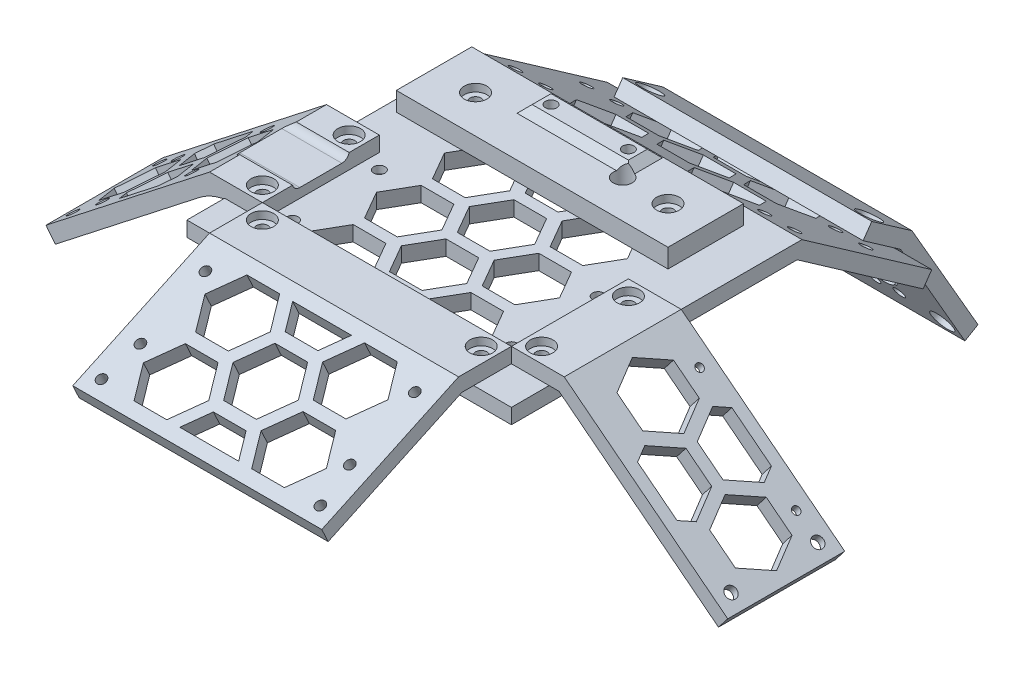
from build123d import *

# Parameters (mm, degrees)
SKETCH2_W                        = 72
SKETCH2_H                        = 20
BOSS_EXTRUDE1_DEPTH              = 5
SKETCH1_R                        = 6
SKETCH1_R_2                      = 3
BOSS_EXTRUDE2_DEPTH              = 4
SKETCH3_R                        = 1.5
CUT_EXTRUDE1_DEPTH               = 39.431757701
SKETCH4_R                        = 3
CUT_EXTRUDE2_DEPTH               = 2
SKETCH6_R                        = 1.3
SKETCH6_R_2                      = 1.5
BOSS_EXTRUDE4_DEPTH              = 4
SKETCH8_R                        = 2.5
CUT_EXTRUDE3_DEPTH               = 74.042795675
SKETCH10_R                       = 1.5
CUT_EXTRUDE4_DEPTH               = 5
BOSS_EXTRUDE6_START              = 2
SKETCH11_W                       = 25.5
SKETCH11_H                       = 5
SKETCH11_R                       = 1.5
BOSS_EXTRUDE6_DEPTH              = 2
SKETCH12_R                       = 3
CUT_EXTRUDE5_DEPTH               = 2
CUT_EXTRUDE6_START               = -2
SKETCH14_R                       = 3
CUT_EXTRUDE6_DEPTH               = 2
SKETCH15_W                       = 14
SKETCH15_H                       = 31
SKETCH15_R                       = 1.5
BOSS_EXTRUDE7_DEPTH              = 4
BOSS_EXTRUDE8_DEPTH              = 31
SKETCH18_R                       = 3
CUT_EXTRUDE7_DEPTH               = 2
SKETCH19_R                       = 1.5
CUT_EXTRUDE8_DEPTH               = 111.725400051
SKETCH20_R                       = 3
CUT_EXTRUDE9_DEPTH               = 2
SKETCH21_W                       = 66
SKETCH21_H                       = 14
SKETCH21_R                       = 1.5
BOSS_EXTRUDE9_DEPTH              = 4
SKETCH22_R                       = 3
CUT_EXTRUDE10_DEPTH              = 2
BOSS_EXTRUDE10_DEPTH             = 66
SKETCH25_W                       = 57.340591448
SKETCH25_H                       = 15
CUT_EXTRUDE11_DEPTH              = 1.5
FILLET1_R                        = 2
FILLET2_R                        = 15
SKETCH28_R                       = 1.25
CUT_EXTRUDE12_DEPTH              = 4
CUT_EXTRUDE13_DEPTH              = 4
SKETCH30_W                       = 14
SKETCH30_H                       = 31
SKETCH30_R                       = 1.5
BOSS_EXTRUDE11_DEPTH             = 4
BOSS_EXTRUDE12_DEPTH             = 31
SKETCH32_R                       = 1.5
SKETCH32_R_2                     = 1
CUT_EXTRUDE14_DEPTH              = 4
CUT_EXTRUDE15_DEPTH              = 4
SKETCH34_R                       = 3
SKETCH34_R_2                     = 2.5
CUT_EXTRUDE16_DEPTH              = 2
CUT_EXTRUDE17_DEPTH              = 4
SKETCH37_R                       = 3
CUT_EXTRUDE19_DEPTH              = 2
SKETCH38_W                       = 86
SKETCH38_H                       = 40
CUT_EXTRUDE20_DEPTH              = 138.852557687
BOSS_EXTRUDE13_REACH             = 140.865
BOSS_EXTRUDE13_DIRECTION_2_REACH = 140.865
SKETCH40_R                       = 1.5
CUT_EXTRUDE21_DEPTH              = 4
CUT_EXTRUDE22_DEPTH              = 2
CUT_EXTRUDE23_DEPTH              = 4
CUT_EXTRUDE24_DEPTH              = 4
SKETCH44_W                       = 66
SKETCH44_H                       = 13
SKETCH44_R                       = 1.5
BOSS_EXTRUDE14_DEPTH             = 4
BOSS_EXTRUDE15_DEPTH             = 66
SKETCH48_R                       = 1.5
CUT_EXTRUDE25_DEPTH              = 4
SKETCH49_R                       = 3
CUT_EXTRUDE26_DEPTH              = 2
SKETCH51_R                       = 3
CUT_EXTRUDE28_DEPTH              = 2


with BuildPart() as part:
    # Sketch2 → Boss-Extrude1 (new body)
    with BuildSketch(Plane(origin=(0, 0, 0), x_dir=(1, 0, 0), z_dir=(0, 1, 0))):
        Rectangle(SKETCH2_W, SKETCH2_H)
    extrude(amount=BOSS_EXTRUDE1_DEPTH)

    # Sketch1 → Boss-Extrude2 (add)
    with BuildSketch(Plane(origin=(0, 0, 0), x_dir=(1, 0, 0), z_dir=(0, 1, 0))):
        with Locations(Location((-25, 0, 0), (0, 0, 270))):
            Circle(SKETCH1_R)
        with Locations(Location((26, 0, 0), (0, 0, 270))):
            Circle(SKETCH1_R_2)
    extrude(amount=-BOSS_EXTRUDE2_DEPTH)

    # Sketch3 → Cut-Extrude1 (cut, through all)
    with BuildSketch(Plane.XZ.offset(4)):
        with Locations(Location((-25, 0, 0), (0, 0, 270))):
            Circle(SKETCH3_R)
        with Locations(Location((26, 0, 0), (0, 0, 270))):
            Circle(SKETCH3_R)
    extrude(amount=-CUT_EXTRUDE1_DEPTH, mode=Mode.SUBTRACT)

    # Sketch4 → Cut-Extrude2 (cut)
    with BuildSketch(Plane(origin=(0, 5, 0), x_dir=(1, 0, 0), z_dir=(0, 1, 0))):
        with Locations(Location((-25, 0, 0), (0, 0, 270))):
            Circle(SKETCH4_R)
        with Locations(Location((26, 0, 0), (0, 0, 270))):
            Circle(SKETCH4_R)
    extrude(amount=-CUT_EXTRUDE2_DEPTH, mode=Mode.SUBTRACT)

    # Sketch8 → Cut-Extrude3 (cut, through all)
    with BuildSketch(Plane.XZ):
        with Locations(Location((14, 0, 0), (0, 0, 270))):
            Circle(SKETCH8_R)
    extrude(amount=-CUT_EXTRUDE3_DEPTH, mode=Mode.SUBTRACT)

    # Sketch10 → Cut-Extrude4 (cut)
    with BuildSketch(Plane(origin=(0, 5, 0), x_dir=(1, 0, 0), z_dir=(0, 1, 0))):
        with Locations(Location((-10.25, 5.25, 0), (0, 0, 270))):
            Circle(SKETCH10_R)
        with Locations(Location((10.25, 5.25, 0), (0, 0, 270))):
            Circle(SKETCH10_R)
    extrude(amount=-CUT_EXTRUDE4_DEPTH, mode=Mode.SUBTRACT)

    # Sketch11 → Boss-Extrude6 (add)
    with BuildSketch(Plane(origin=(0, 5, 0), x_dir=(1, 0, 0), z_dir=(0, 1, 0)).offset(BOSS_EXTRUDE6_START)):
        with Locations((0, 5.25)):
            Rectangle(SKETCH11_W, SKETCH11_H)
        with Locations(Location((-10.25, 5.25, 0), (0, 0, 270))):
            Circle(SKETCH11_R, mode=Mode.SUBTRACT)
        with Locations(Location((10.25, 5.25, 0), (0, 0, 270))):
            Circle(SKETCH11_R, mode=Mode.SUBTRACT)
    extrude(amount=-BOSS_EXTRUDE6_DEPTH)

    # Chamfer2
    # the kernel refuses this chamfer: 2 mm, written as the material it adds along each edge
    with BuildSketch(Plane(origin=(-12.75, 5, -2.75), x_dir=(0, -0.027495876610586487, 0.9996219169112968), z_dir=(1, 0, 0))) as chamfer2_piece_1_section:
        with BuildLine():
            Line((2.05734639, 0), (-0.11309431, -2.054235587))
            Line((-0.11309431, -2.054235587), (-0.153079186, -2.053135752))
            ThreePointArc((-0.153079186, -2.053135752), (-0.068258454, -1.026795659), (-0.039984877, 0.001099835))
            Line((-0.039984877, 0.001099835), (0.001099835, 0.039984877))
            ThreePointArc((0.001099835, 0.039984877), (1.028995329, 0.011711299), (2.058446225, 0.039984877))
            Line((2.058446225, 0.039984877), (2.05734639, 0))
        make_face()
    chamfer2_piece_1 = extrude(amount=25.5, mode=Mode.PRIVATE)
    chamfer2_piece_1 = chamfer2_piece_1 - Plane(origin=(14, 5.660762518, 0), x_dir=(0, 0, -1), z_dir=(0, -1, 0)) * Cylinder(2.5, 60, mode=Mode.PRIVATE)
    chamfer2_piece_1 = split(chamfer2_piece_1, bisect_by=Plane(origin=(-0.134065272, 7, -2.095887334), z_dir=(0, -1, 0)), keep=Keep.TOP, mode=Mode.PRIVATE)
    add(chamfer2_piece_1)
    with BuildSketch(Plane(origin=(12.75, 5, -2.75), x_dir=(0.9996219169112968, -0.027495876610586487, 0), z_dir=(0, 0, -1))) as chamfer2_piece_2_section:
        with BuildLine():
            Line((2.05734639, 0), (-0.11309431, -2.054235587))
            Line((-0.11309431, -2.054235587), (-0.153079186, -2.053135752))
            ThreePointArc((-0.153079186, -2.053135752), (-0.068258454, -1.026795659), (-0.039984877, 0.001099835))
            Line((-0.039984877, 0.001099835), (0.001099835, 0.039984877))
            ThreePointArc((0.001099835, 0.039984877), (1.028995329, 0.011711299), (2.058446225, 0.039984877))
            Line((2.058446225, 0.039984877), (2.05734639, 0))
        make_face()
    chamfer2_piece_2 = extrude(amount=5, mode=Mode.PRIVATE)
    chamfer2_piece_2 = split(chamfer2_piece_2, bisect_by=Plane(origin=(13.410808309, 7, -5.25), z_dir=(0, -1, 0)), keep=Keep.TOP, mode=Mode.PRIVATE)
    add(chamfer2_piece_2)
    with BuildSketch(Plane(origin=(12.75, 5, -7.75), x_dir=(0, -0.027495876610586487, -0.9996219169112968), z_dir=(-1, 0, 0))) as chamfer2_piece_3_section:
        with BuildLine():
            Line((2.05734639, 0), (-0.11309431, -2.054235587))
            Line((-0.11309431, -2.054235587), (-0.153079186, -2.053135752))
            ThreePointArc((-0.153079186, -2.053135752), (-0.068258454, -1.026795659), (-0.039984877, 0.001099835))
            Line((-0.039984877, 0.001099835), (0.001099835, 0.039984877))
            ThreePointArc((0.001099835, 0.039984877), (1.028995329, 0.011711299), (2.058446225, 0.039984877))
            Line((2.058446225, 0.039984877), (2.05734639, 0))
        make_face()
    chamfer2_piece_3 = extrude(amount=25.5, mode=Mode.PRIVATE)
    chamfer2_piece_3 = split(chamfer2_piece_3, bisect_by=Plane(origin=(0, 7, -8.410808309), z_dir=(0, -1, 0)), keep=Keep.TOP, mode=Mode.PRIVATE)
    add(chamfer2_piece_3)
    with BuildSketch(Plane(origin=(-12.75, 5, -7.75), x_dir=(-0.9996219169112968, -0.027495876610586487, 0), z_dir=(0, 0, 1))) as chamfer2_piece_4_section:
        with BuildLine():
            Line((2.05734639, 0), (-0.11309431, -2.054235587))
            Line((-0.11309431, -2.054235587), (-0.153079186, -2.053135752))
            ThreePointArc((-0.153079186, -2.053135752), (-0.068258454, -1.026795659), (-0.039984877, 0.001099835))
            Line((-0.039984877, 0.001099835), (0.001099835, 0.039984877))
            ThreePointArc((0.001099835, 0.039984877), (1.028995329, 0.011711299), (2.058446225, 0.039984877))
            Line((2.058446225, 0.039984877), (2.05734639, 0))
        make_face()
    chamfer2_piece_4 = extrude(amount=5, mode=Mode.PRIVATE)
    chamfer2_piece_4 = split(chamfer2_piece_4, bisect_by=Plane(origin=(-13.410808309, 7, -5.25), z_dir=(0, -1, 0)), keep=Keep.TOP, mode=Mode.PRIVATE)
    add(chamfer2_piece_4)
    with BuildSketch(Plane(origin=(-12.75, 5, -7.75), x_dir=(-0.9996219169112968, -0.027495876610586487, 0), z_dir=(0, 0, 1))) as chamfer2_piece_5a_section:
        with BuildLine():
            Line((2.05734639, 0), (-0.11309431, -2.054235587))
            Line((-0.11309431, -2.054235587), (-0.153079186, -2.053135752))
            ThreePointArc((-0.153079186, -2.053135752), (-0.068258454, -1.026795659), (-0.039984877, 0.001099835))
            Line((-0.039984877, 0.001099835), (0.001099835, 0.039984877))
            ThreePointArc((0.001099835, 0.039984877), (1.028995329, 0.011711299), (2.058446225, 0.039984877))
            Line((2.058446225, 0.039984877), (2.05734639, 0))
        make_face()
    chamfer2_piece_5a = extrude(amount=7.05734639, mode=Mode.PRIVATE)
    chamfer2_piece_5a = split(chamfer2_piece_5a, bisect_by=Plane(origin=(-13.410808309, 7, -1.721326805), z_dir=(0, -1, 0)), keep=Keep.TOP, mode=Mode.PRIVATE)
    chamfer2_piece_5a = split(chamfer2_piece_5a, bisect_by=Plane(origin=(-13.410808309, 5.657268668, -2.75), z_dir=(0, 0, 1)), keep=Keep.TOP, mode=Mode.PRIVATE)
    with BuildSketch(Plane(origin=(-14.80734639, 5, -2.75), x_dir=(0, -0.027495876610586487, 0.9996219169112968), z_dir=(1, 0, 0))) as chamfer2_piece_5b_section:
        with BuildLine():
            Line((2.05734639, 0), (-0.11309431, -2.054235587))
            Line((-0.11309431, -2.054235587), (-0.153079186, -2.053135752))
            ThreePointArc((-0.153079186, -2.053135752), (-0.068258454, -1.026795659), (-0.039984877, 0.001099835))
            Line((-0.039984877, 0.001099835), (0.001099835, 0.039984877))
            ThreePointArc((0.001099835, 0.039984877), (1.028995329, 0.011711299), (2.058446225, 0.039984877))
            Line((2.058446225, 0.039984877), (2.05734639, 0))
        make_face()
    chamfer2_piece_5b = extrude(amount=27.55734639, mode=Mode.PRIVATE)
    chamfer2_piece_5b = split(chamfer2_piece_5b, bisect_by=Plane(origin=(-13.778673195, 7, -2.089191691), z_dir=(0, -1, 0)), keep=Keep.TOP, mode=Mode.PRIVATE)
    chamfer2_piece_5b = split(chamfer2_piece_5b, bisect_by=Plane(origin=(-12.75, 5.657268668, -2.089191691), z_dir=(-1, 0, 0)), keep=Keep.TOP, mode=Mode.PRIVATE)
    chamfer2_piece_5 = chamfer2_piece_5a & chamfer2_piece_5b
    add(chamfer2_piece_5)
    with BuildSketch(Plane(origin=(-12.75, 5, -2.75), x_dir=(0, -0.027495876610586487, 0.9996219169112968), z_dir=(1, 0, 0))) as chamfer2_piece_6a_section:
        with BuildLine():
            Line((2.05734639, 0), (-0.11309431, -2.054235587))
            Line((-0.11309431, -2.054235587), (-0.153079186, -2.053135752))
            ThreePointArc((-0.153079186, -2.053135752), (-0.068258454, -1.026795659), (-0.039984877, 0.001099835))
            Line((-0.039984877, 0.001099835), (0.001099835, 0.039984877))
            ThreePointArc((0.001099835, 0.039984877), (1.028995329, 0.011711299), (2.058446225, 0.039984877))
            Line((2.058446225, 0.039984877), (2.05734639, 0))
        make_face()
    chamfer2_piece_6a = extrude(amount=27.55734639, mode=Mode.PRIVATE)
    chamfer2_piece_6a = chamfer2_piece_6a - Plane(origin=(14, 5.933617383, 0), x_dir=(0, 0, -1), z_dir=(0, -1, 0)) * Cylinder(2.5, 64, mode=Mode.PRIVATE)
    chamfer2_piece_6a = split(chamfer2_piece_6a, bisect_by=Plane(origin=(13.702845422, 7, -2.606312664), z_dir=(0, -1, 0)), keep=Keep.TOP, mode=Mode.PRIVATE)
    chamfer2_piece_6a = split(chamfer2_piece_6a, bisect_by=Plane(origin=(12.75, 5.933617383, -2.606312664), z_dir=(1, 0, 0)), keep=Keep.TOP, mode=Mode.PRIVATE)
    with BuildSketch(Plane(origin=(12.75, 5, -0.69265361), x_dir=(0.9996219169112968, -0.027495876610586487, 0), z_dir=(0, 0, -1))) as chamfer2_piece_6b_section:
        with BuildLine():
            Line((2.05734639, 0), (-0.11309431, -2.054235587))
            Line((-0.11309431, -2.054235587), (-0.153079186, -2.053135752))
            ThreePointArc((-0.153079186, -2.053135752), (-0.068258454, -1.026795659), (-0.039984877, 0.001099835))
            Line((-0.039984877, 0.001099835), (0.001099835, 0.039984877))
            ThreePointArc((0.001099835, 0.039984877), (1.028995329, 0.011711299), (2.058446225, 0.039984877))
            Line((2.058446225, 0.039984877), (2.05734639, 0))
        make_face()
    chamfer2_piece_6b = extrude(amount=7.05734639, mode=Mode.PRIVATE)
    chamfer2_piece_6b = chamfer2_piece_6b - Plane(origin=(14, 5.726450415, 0), x_dir=(0, 0, -1), z_dir=(0, -1, 0)) * Cylinder(2.5, 23, mode=Mode.PRIVATE)
    chamfer2_piece_6b = split(chamfer2_piece_6b, bisect_by=Plane(origin=(13.28343187, 7, -2.545767831), z_dir=(0, -1, 0)), keep=Keep.TOP, mode=Mode.PRIVATE)
    chamfer2_piece_6b = split(chamfer2_piece_6b, bisect_by=Plane(origin=(13.28343187, 5.726450415, -2.75), z_dir=(0, 0, 1)), keep=Keep.TOP, mode=Mode.PRIVATE)
    chamfer2_piece_6 = chamfer2_piece_6a & chamfer2_piece_6b
    add(chamfer2_piece_6)
    with BuildSketch(Plane(origin=(12.75, 5, -2.75), x_dir=(0.9996219169112968, -0.027495876610586487, 0), z_dir=(0, 0, -1))) as chamfer2_piece_7a_section:
        with BuildLine():
            Line((2.05734639, 0), (-0.11309431, -2.054235587))
            Line((-0.11309431, -2.054235587), (-0.153079186, -2.053135752))
            ThreePointArc((-0.153079186, -2.053135752), (-0.068258454, -1.026795659), (-0.039984877, 0.001099835))
            Line((-0.039984877, 0.001099835), (0.001099835, 0.039984877))
            ThreePointArc((0.001099835, 0.039984877), (1.028995329, 0.011711299), (2.058446225, 0.039984877))
            Line((2.058446225, 0.039984877), (2.05734639, 0))
        make_face()
    chamfer2_piece_7a = extrude(amount=7.05734639, mode=Mode.PRIVATE)
    chamfer2_piece_7a = split(chamfer2_piece_7a, bisect_by=Plane(origin=(13.410808309, 5.657268668, -7.75), z_dir=(0, 0, -1)), keep=Keep.TOP, mode=Mode.PRIVATE)
    chamfer2_piece_7a = split(chamfer2_piece_7a, bisect_by=Plane(origin=(13.410808309, 7, -8.778673195), z_dir=(0, -1, 0)), keep=Keep.TOP, mode=Mode.PRIVATE)
    with BuildSketch(Plane(origin=(14.80734639, 5, -7.75), x_dir=(0, -0.027495876610586487, -0.9996219169112968), z_dir=(-1, 0, 0))) as chamfer2_piece_7b_section:
        with BuildLine():
            Line((2.05734639, 0), (-0.11309431, -2.054235587))
            Line((-0.11309431, -2.054235587), (-0.153079186, -2.053135752))
            ThreePointArc((-0.153079186, -2.053135752), (-0.068258454, -1.026795659), (-0.039984877, 0.001099835))
            Line((-0.039984877, 0.001099835), (0.001099835, 0.039984877))
            ThreePointArc((0.001099835, 0.039984877), (1.028995329, 0.011711299), (2.058446225, 0.039984877))
            Line((2.058446225, 0.039984877), (2.05734639, 0))
        make_face()
    chamfer2_piece_7b = extrude(amount=27.55734639, mode=Mode.PRIVATE)
    chamfer2_piece_7b = split(chamfer2_piece_7b, bisect_by=Plane(origin=(12.75, 5.657268668, -8.410808309), z_dir=(1, 0, 0)), keep=Keep.TOP, mode=Mode.PRIVATE)
    chamfer2_piece_7b = split(chamfer2_piece_7b, bisect_by=Plane(origin=(13.778673195, 7, -8.410808309), z_dir=(0, -1, 0)), keep=Keep.TOP, mode=Mode.PRIVATE)
    chamfer2_piece_7 = chamfer2_piece_7a & chamfer2_piece_7b
    add(chamfer2_piece_7)
    with BuildSketch(Plane(origin=(-12.75, 5, -9.80734639), x_dir=(-0.9996219169112968, -0.027495876610586487, 0), z_dir=(0, 0, 1))) as chamfer2_piece_8a_section:
        with BuildLine():
            Line((2.05734639, 0), (-0.11309431, -2.054235587))
            Line((-0.11309431, -2.054235587), (-0.153079186, -2.053135752))
            ThreePointArc((-0.153079186, -2.053135752), (-0.068258454, -1.026795659), (-0.039984877, 0.001099835))
            Line((-0.039984877, 0.001099835), (0.001099835, 0.039984877))
            ThreePointArc((0.001099835, 0.039984877), (1.028995329, 0.011711299), (2.058446225, 0.039984877))
            Line((2.058446225, 0.039984877), (2.05734639, 0))
        make_face()
    chamfer2_piece_8a = extrude(amount=7.05734639, mode=Mode.PRIVATE)
    chamfer2_piece_8a = split(chamfer2_piece_8a, bisect_by=Plane(origin=(-13.410808309, 5.657268668, -7.75), z_dir=(0, 0, -1)), keep=Keep.TOP, mode=Mode.PRIVATE)
    chamfer2_piece_8a = split(chamfer2_piece_8a, bisect_by=Plane(origin=(-13.410808309, 7, -8.778673195), z_dir=(0, -1, 0)), keep=Keep.TOP, mode=Mode.PRIVATE)
    with BuildSketch(Plane(origin=(12.75, 5, -7.75), x_dir=(0, -0.027495876610586487, -0.9996219169112968), z_dir=(-1, 0, 0))) as chamfer2_piece_8b_section:
        with BuildLine():
            Line((2.05734639, 0), (-0.11309431, -2.054235587))
            Line((-0.11309431, -2.054235587), (-0.153079186, -2.053135752))
            ThreePointArc((-0.153079186, -2.053135752), (-0.068258454, -1.026795659), (-0.039984877, 0.001099835))
            Line((-0.039984877, 0.001099835), (0.001099835, 0.039984877))
            ThreePointArc((0.001099835, 0.039984877), (1.028995329, 0.011711299), (2.058446225, 0.039984877))
            Line((2.058446225, 0.039984877), (2.05734639, 0))
        make_face()
    chamfer2_piece_8b = extrude(amount=27.55734639, mode=Mode.PRIVATE)
    chamfer2_piece_8b = split(chamfer2_piece_8b, bisect_by=Plane(origin=(-12.75, 5.657268668, -8.410808309), z_dir=(-1, 0, 0)), keep=Keep.TOP, mode=Mode.PRIVATE)
    chamfer2_piece_8b = split(chamfer2_piece_8b, bisect_by=Plane(origin=(-13.778673195, 7, -8.410808309), z_dir=(0, -1, 0)), keep=Keep.TOP, mode=Mode.PRIVATE)
    chamfer2_piece_8 = chamfer2_piece_8a & chamfer2_piece_8b
    add(chamfer2_piece_8)

    # Sketch12 → Cut-Extrude5 (cut)
    with BuildSketch(Plane.XZ):
        with Locations(Location((-10.25, -5.25, 0), (0, 0, 270))):
            Circle(SKETCH12_R)
        with Locations(Location((10.25, -5.25, 0), (0, 0, 270))):
            Circle(SKETCH12_R)
    extrude(amount=-CUT_EXTRUDE5_DEPTH, mode=Mode.SUBTRACT)


with BuildPart() as body_2:
    # Sketch6 → Boss-Extrude4 (new body)
    with BuildSketch(Plane.XZ.offset(4)):
        Polygon((-36, -58.5), (36, -58.5), (43, -58.5), (43, 58.5), (36, 58.5), (-36, 58.5), (-43, 58.5), (-43, -58.5), align=None)
        with Locations(Location((-29, -21.5, 0), (0, 0, 270))):
            Circle(SKETCH6_R, mode=Mode.SUBTRACT)
        with Locations(Location((-29, -44.5, 0), (0, 0, 270))):
            Circle(SKETCH6_R, mode=Mode.SUBTRACT)
        with Locations(Location((29, -44.5, 0), (0, 0, 90))):
            Circle(SKETCH6_R, mode=Mode.SUBTRACT)
        with Locations(Location((29, -21.5, 0), (0, 0, 90))):
            Circle(SKETCH6_R, mode=Mode.SUBTRACT)
        with Locations(Location((-25, 0, 0), (0, 0, 270))):
            Circle(SKETCH6_R_2, mode=Mode.SUBTRACT)
        with Locations(Location((26, 0, 0), (0, 0, 270))):
            Circle(SKETCH6_R_2, mode=Mode.SUBTRACT)
        with Locations(Location((-29, 44.5, 0), (0, 0, 270))):
            Circle(SKETCH6_R_2, mode=Mode.SUBTRACT)
        with Locations(Location((-29, 21.5, 0), (0, 0, 270))):
            Circle(SKETCH6_R_2, mode=Mode.SUBTRACT)
        with Locations(Location((29, 21.5, 0), (0, 0, 270))):
            Circle(SKETCH6_R_2, mode=Mode.SUBTRACT)
        with Locations(Location((29, 44.5, 0), (0, 0, 270))):
            Circle(SKETCH6_R_2, mode=Mode.SUBTRACT)
        with Locations(Location((-29, 52.5, 0), (0, 0, 270))):
            Circle(SKETCH6_R_2, mode=Mode.SUBTRACT)
        with Locations(Location((29, 52.5, 0), (0, 0, 90))):
            Circle(SKETCH6_R_2, mode=Mode.SUBTRACT)
        with Locations(Location((29, -52.5, 0), (0, 0, 270))):
            Circle(SKETCH6_R_2, mode=Mode.SUBTRACT)
        with Locations(Location((-29, -52.5, 0), (0, 0, 90))):
            Circle(SKETCH6_R_2, mode=Mode.SUBTRACT)
        with Locations(Location((-37, 44.5, 0), (0, 0, 270))):
            Circle(SKETCH6_R_2, mode=Mode.SUBTRACT)
        with Locations(Location((-37, 21.5, 0), (0, 0, 270))):
            Circle(SKETCH6_R_2, mode=Mode.SUBTRACT)
        with Locations(Location((37, 44.5, 0), (0, 0, 90))):
            Circle(SKETCH6_R_2, mode=Mode.SUBTRACT)
        with Locations(Location((37, 21.5, 0), (0, 0, 90))):
            Circle(SKETCH6_R_2, mode=Mode.SUBTRACT)
        with Locations(Location((37, -44.5, 0), (0, 0, 270))):
            Circle(SKETCH6_R_2, mode=Mode.SUBTRACT)
        with Locations(Location((37, -21.5, 0), (0, 0, 270))):
            Circle(SKETCH6_R_2, mode=Mode.SUBTRACT)
        with Locations(Location((-37, -21.5, 0), (0, 0, 90))):
            Circle(SKETCH6_R_2, mode=Mode.SUBTRACT)
        with Locations(Location((-37, -44.5, 0), (0, 0, 90))):
            Circle(SKETCH6_R_2, mode=Mode.SUBTRACT)
    extrude(amount=BOSS_EXTRUDE4_DEPTH)

    # Sketch14 → Cut-Extrude6 (cut)
    with BuildSketch(Plane.XZ.offset(8).offset(CUT_EXTRUDE6_START)):
        with Locations(Location((-25, 0, 0), (0, 0, 270))):
            Circle(SKETCH14_R)
        with Locations(Location((26, 0, 0), (0, 0, 270))):
            Circle(SKETCH14_R)
        with BuildLine():
            Line((-37, 47.500000004), (-32, 47.500000004))
            Line((-32, 47.500000004), (-32, 52.5))
            ThreePointArc((-32, 52.5), (-29, 55.5), (-26, 52.5))
            Line((-26, 52.5), (-26, 44.5))
            ThreePointArc((-26, 44.5), (-26.878679659, 42.378679659), (-29, 41.500000004))
            Line((-29, 41.500000004), (-37, 41.500000004))
            ThreePointArc((-37, 41.500000004), (-40.000000004, 44.5), (-37, 47.500000004))
        make_face()
        with BuildLine():
            Line((-37, 24.5), (-29, 24.5))
            ThreePointArc((-29, 24.5), (-26, 21.5), (-29, 18.5))
            Line((-29, 18.5), (-37, 18.5))
            ThreePointArc((-37, 18.5), (-40, 21.5), (-37, 24.5))
        make_face()
        with BuildLine():
            Line((37, 18.5), (29, 18.5))
            ThreePointArc((29, 18.5), (26, 21.5), (29, 24.5))
            Line((29, 24.5), (37, 24.5))
            ThreePointArc((37, 24.5), (40, 21.5), (37, 18.5))
        make_face()
        with BuildLine():
            Line((26, 44.5), (26, 52.5))
            ThreePointArc((26, 52.5), (29, 55.5), (32, 52.5))
            Line((32, 52.5), (32, 47.500000004))
            Line((32, 47.500000004), (37, 47.500000004))
            ThreePointArc((37, 47.500000004), (40.000000004, 44.5), (37, 41.500000004))
            Line((37, 41.500000004), (29, 41.500000004))
            ThreePointArc((29, 41.500000004), (26.878679659, 42.378679659), (26, 44.5))
        make_face()
        with BuildLine():
            Line((36.998644538, -47.502282814), (31.99864454, -47.502140137))
            Line((31.99864454, -47.502140137), (31.998501863, -52.502140131))
            ThreePointArc((31.998501863, -52.502140131), (28.998416258, -55.502054523), (25.998501865, -52.501968918))
            Line((25.998501865, -52.501968918), (25.998730148, -44.501968922))
            ThreePointArc((25.998730148, -44.501968922), (26.87747034, -42.380673655), (28.998815753, -41.502054533))
            Line((28.998815753, -41.502054533), (36.99881575, -41.502282816))
            ThreePointArc((36.99881575, -41.502282816), (39.998730147, -44.502368417), (36.998644538, -47.502282814))
        make_face()
        with BuildLine():
            Line((36.999300851, -24.502282819), (28.999300854, -24.502054536))
            ThreePointArc((28.999300854, -24.502054536), (25.999386462, -21.501968931), (28.999472067, -18.502054538))
            Line((28.999472067, -18.502054538), (36.999472063, -18.502282821))
            ThreePointArc((36.999472063, -18.502282821), (39.999386456, -21.502368426), (36.999300851, -24.502282819))
        make_face()
        with BuildLine():
            Line((-37.000527907, -18.500171205), (-29.00052791, -18.500399488))
            ThreePointArc((-29.00052791, -18.500399488), (-26.000613517, -21.500485092), (-29.000699122, -24.500399485))
            Line((-29.000699122, -24.500399485), (-37.000699119, -24.500171202))
            ThreePointArc((-37.000699119, -24.500171202), (-40.000613511, -21.500085597), (-37.000527907, -18.500171205))
        make_face()
        with BuildLine():
            Line((-26.00126983, -44.500485083), (-26.001498113, -52.50048508))
            ThreePointArc((-26.001498113, -52.50048508), (-29.001583718, -55.500399472), (-32.001498111, -52.500313868))
            Line((-32.001498111, -52.500313868), (-32.001355434, -47.500313874))
            Line((-32.001355434, -47.500313874), (-37.001355432, -47.500171197))
            ThreePointArc((-37.001355432, -47.500171197), (-40.001269829, -44.500085588), (-37.00118422, -41.500171199))
            Line((-37.00118422, -41.500171199), (-29.001184223, -41.500399482))
            ThreePointArc((-29.001184223, -41.500399482), (-26.879888956, -42.379139669), (-26.00126983, -44.500485083))
        make_face()
    extrude(amount=CUT_EXTRUDE6_DEPTH, mode=Mode.SUBTRACT)

    # Sketch38 → Cut-Extrude20 (cut, through all)
    with BuildSketch(Plane(origin=(0, -4, 0), x_dir=(1, 0, 0), z_dir=(0, 1, 0))):
        with Locations((0, 38.5)):
            Rectangle(SKETCH38_W, SKETCH38_H)
    extrude(amount=-CUT_EXTRUDE20_DEPTH, mode=Mode.SUBTRACT)

    # Boss-Extrude13: up to this face of the body (flat: up to its plane)
    boss_extrude13_end = Plane(body_2.part.faces().sort_by_distance((43, -6, 20))[0])
    # Sketch39 → Boss-Extrude13 (add, up to the picked face)
    with BuildSketch(Plane(origin=(0, 0, 0), x_dir=(0, 0, -1), z_dir=(1, 0, 0)), mode=Mode.PRIVATE) as boss_extrude13_sk1:
        Polygon((18.5, -4), (52.90438586, -28.090210327), (50.610080115, -31.366818504), (17.238804844, -8), align=None)
    boss_extrude13_tool1 = split(extrude(boss_extrude13_sk1.sketch, amount=BOSS_EXTRUDE13_REACH, mode=Mode.PRIVATE), bisect_by=boss_extrude13_end, keep=Keep.BOTH, mode=Mode.PRIVATE)
    add(boss_extrude13_tool1.solids().sort_by(Axis((0, -17.855014, -34.817834), (1, 0, 0)))[0])

    # Boss-Extrude13 direction 2: up to this face of the body (flat: up to its plane)
    boss_extrude13_direction_2_end = Plane(body_2.part.faces().sort_by_distance((-43, -6, 20))[0])
    # Sketch39 → Boss-Extrude13 direction 2 (add, up to the picked face)
    with BuildSketch(Plane(origin=(0, 0, 0), x_dir=(0, 0, -1), z_dir=(1, 0, 0)), mode=Mode.PRIVATE) as boss_extrude13_direction_2_sk1:
        Polygon((18.5, -4), (52.90438586, -28.090210327), (50.610080115, -31.366818504), (17.238804844, -8), align=None)
    boss_extrude13_direction_2_tool1 = split(extrude(boss_extrude13_direction_2_sk1.sketch, amount=-BOSS_EXTRUDE13_DIRECTION_2_REACH, mode=Mode.PRIVATE), bisect_by=boss_extrude13_direction_2_end, keep=Keep.BOTH, mode=Mode.PRIVATE)
    add(boss_extrude13_direction_2_tool1.solids().sort_by(Axis((0, -17.855014, -34.817834), (-1, 0, 0)))[0])

    # Sketch40 → Cut-Extrude21 (cut)
    with BuildSketch(Plane(origin=(0, 6.008116456, -4.206928433), x_dir=(1, 0, 0), z_dir=(0, 0.819152044288995, -0.5735764363510415))):
        with Locations(Location((-29, 22.448618565, 0), (0, 0, 270))):
            Circle(SKETCH40_R)
        with Locations(Location((-37, 22.448618565, 0), (0, 0, 270))):
            Circle(SKETCH40_R)
        with Locations(Location((-29, 45.448618565, 0), (0, 0, 270))):
            Circle(SKETCH40_R)
        with Locations(Location((-37, 45.448618565, 0), (0, 0, 270))):
            Circle(SKETCH40_R)
        with Locations(Location((-29, 53.448618565, 0), (0, 0, 270))):
            Circle(SKETCH40_R)
        with Locations(Location((29, 53.448618565, 0), (0, 0, 270))):
            Circle(SKETCH40_R)
        with Locations(Location((37, 45.448618565, 0), (0, 0, 270))):
            Circle(SKETCH40_R)
        with Locations(Location((29, 45.448618565, 0), (0, 0, 270))):
            Circle(SKETCH40_R)
        with Locations(Location((37, 22.448618565, 0), (0, 0, 270))):
            Circle(SKETCH40_R)
        with Locations(Location((29, 22.448618565, 0), (0, 0, 270))):
            Circle(SKETCH40_R)
    extrude(amount=-CUT_EXTRUDE21_DEPTH, mode=Mode.SUBTRACT)

    # Sketch41 → Cut-Extrude22 (cut)
    with BuildSketch(Plane(origin=(0, 2.731508278, -1.912622687), x_dir=(1, 0, 0), z_dir=(0, -0.8191520442889951, 0.5735764363510415))):
        with BuildLine():
            Line((29, -25.448618565), (37, -25.448618565))
            ThreePointArc((37, -25.448618565), (40, -22.448618565), (37, -19.448618565))
            Line((37, -19.448618565), (29, -19.448618565))
            ThreePointArc((29, -19.448618565), (26, -22.448618565), (29, -25.448618565))
        make_face()
        with BuildLine():
            Line((37, -48.448618565), (32, -47.448618565))
            Line((32, -47.448618565), (32, -53.448618565))
            ThreePointArc((32, -53.448618565), (29, -56.448618565), (26, -53.448618565))
            Line((26, -53.448618565), (26, -45.448618565))
            ThreePointArc((26, -45.448618565), (26.878679656, -43.327298221), (29, -42.448618565))
            Line((29, -42.448618565), (37, -42.448618565))
            ThreePointArc((37, -42.448618565), (40, -45.448618565), (37, -48.448618565))
        make_face()
        with BuildLine():
            Line((-26, -45.448618565), (-26, -53.448618565))
            ThreePointArc((-26, -53.448618565), (-29, -56.448618565), (-32, -53.448618565))
            Line((-32, -53.448618565), (-32, -47.448618565))
            Line((-32, -47.448618565), (-37, -48.448618565))
            ThreePointArc((-37, -48.448618565), (-40, -45.448618565), (-37, -42.448618565))
            Line((-37, -42.448618565), (-29, -42.448618565))
            ThreePointArc((-29, -42.448618565), (-26.878679656, -43.327298221), (-26, -45.448618565))
        make_face()
        with BuildLine():
            Line((-37, -19.448618565), (-29, -19.448618565))
            ThreePointArc((-29, -19.448618565), (-26, -22.448618565), (-29, -25.448618565))
            Line((-29, -25.448618565), (-37, -25.448618565))
            ThreePointArc((-37, -25.448618565), (-40, -22.448618565), (-37, -19.448618565))
        make_face()
    extrude(amount=-CUT_EXTRUDE22_DEPTH, mode=Mode.SUBTRACT)

    # Sketch36 → Cut-Extrude23 (cut)
    with BuildSketch(Plane(origin=(0, -4, 0), x_dir=(1, 0, 0), z_dir=(0, 1, 0))):
        Polygon((-19.918584287, 1.5), (-11.258330249, 1.5), (-6.92820323, 9), (-11.258330249, 16.5), (-19.918584287, 16.5), (-24.248711306, 9), align=None)
        Polygon((-4.330127019, -7.5), (4.330127019, -7.5), (8.660254038, 0), (4.330127019, 7.5), (-4.330127019, 7.5), (-8.660254038, 0), align=None)
        Polygon((11.258330249, 1.5), (19.918584287, 1.5), (24.248711306, 9), (19.918584287, 16.5), (11.258330249, 16.5), (6.92820323, 9), align=None)
        Polygon((11.258330249, -16.5), (19.918584287, -16.5), (24.248711306, -9), (19.918584287, -1.5), (11.258330249, -1.5), (6.92820323, -9), align=None)
        Polygon((-4.330127019, -25.5), (4.330127019, -25.5), (8.660254038, -18), (4.330127019, -10.5), (-4.330127019, -10.5), (-8.660254038, -18), align=None)
        Polygon((-19.918584287, -16.5), (-11.258330249, -16.5), (-6.92820323, -9), (-11.258330249, -1.5), (-19.918584287, -1.5), (-24.248711306, -9), align=None)
        Polygon((-19.918584287, -34.5), (-11.258330249, -34.5), (-6.92820323, -27), (-11.258330249, -19.5), (-19.918584287, -19.5), (-24.248711306, -27), align=None)
        Polygon((-4.330127019, -43.5), (4.330127019, -43.5), (8.660254038, -36), (4.330127019, -28.5), (-4.330127019, -28.5), (-8.660254038, -36), align=None)
        Polygon((11.258330249, -34.5), (19.918584287, -34.5), (24.248711306, -27), (19.918584287, -19.5), (11.258330249, -19.5), (6.92820323, -27), align=None)
        Polygon((11.258330249, -52.5), (19.918584287, -52.5), (24.248711306, -45), (19.918584287, -37.5), (11.258330249, -37.5), (6.92820323, -45), align=None)
        Polygon((-7.794228634, -52.5), (7.794228634, -52.5), (4.330127019, -46.5), (-4.330127019, -46.5), align=None)
        Polygon((-19.918584287, -52.5), (-11.258330249, -52.5), (-6.92820323, -45), (-11.258330249, -37.5), (-19.918584287, -37.5), (-24.248711306, -45), align=None)
    extrude(amount=-CUT_EXTRUDE23_DEPTH, mode=Mode.SUBTRACT)

    # Sketch43 → Cut-Extrude24 (cut)
    with BuildSketch(Plane(origin=(0, 6.008116456, -4.206928433), x_dir=(1, 0, 0), z_dir=(0, 0.819152044288995, -0.5735764363510415))):
        Polygon((-19.918584287, 19.086922653), (-11.258330249, 19.086922653), (-6.92820323, 26.586922653), (-11.258330249, 34.086922653), (-19.918584287, 34.086922653), (-24.248711306, 26.586922653), align=None)
        Polygon((4.330127019, 28.319996358), (8.660254038, 35.819996358), (4.330127019, 43.319996358), (-4.330127019, 43.319996358), (-8.660254038, 35.819996358), (-4.330127019, 28.319996358), align=None)
        Polygon((11.258330249, 19.086922653), (19.918584287, 19.086922653), (24.248711306, 26.586922653), (19.918584287, 34.086922653), (11.258330249, 34.086922653), (6.92820323, 26.586922653), align=None)
        Polygon((6.92820323, 44.819996358), (11.258330249, 37.319996358), (19.918584287, 37.319996358), (24.248711306, 44.819996358), (19.918584287, 52.319996358), (11.258330249, 52.319996358), align=None)
        Polygon((4.330127019, 46.553070063), (8.311273803, 53.448618565), (-8.311273803, 53.448618565), (-4.330127019, 46.553070063), align=None)
        Polygon((-11.258330249, 37.319996358), (-6.92820323, 44.819996358), (-11.258330249, 52.319996358), (-19.918584287, 52.319996358), (-24.248711306, 44.819996358), (-19.918584287, 37.319996358), align=None)
    extrude(amount=-CUT_EXTRUDE24_DEPTH, mode=Mode.SUBTRACT)


with BuildPart() as body_3:
    # Sketch15 → Boss-Extrude7 (new body)
    with BuildSketch(Plane(origin=(0, -4, 0), x_dir=(1, 0, 0), z_dir=(0, 1, 0))):
        with Locations((-40, -33)):
            Rectangle(SKETCH15_W, SKETCH15_H)
        with Locations(Location((-37, -21.5, 0), (0, 0, 270))):
            Circle(SKETCH15_R, mode=Mode.SUBTRACT)
        with Locations(Location((-37, -44.5, 0), (0, 0, 270))):
            Circle(SKETCH15_R, mode=Mode.SUBTRACT)
    extrude(amount=BOSS_EXTRUDE7_DEPTH)

    # Sketch17 → Boss-Extrude8 (add)
    with BuildSketch(Plane.XY.offset(48.5)):
        Polygon((-47, 0), (-90.340591448, -33.861381143), (-87.877945547, -37.013424157), (-45.622689547, -4), align=None)
    extrude(amount=-BOSS_EXTRUDE8_DEPTH)

    # Sketch18 → Cut-Extrude7 (cut)
    with BuildSketch(Plane(origin=(0, 0, 0), x_dir=(1, 0, 0), z_dir=(0, 1, 0))):
        with Locations(Location((-37, -21.5, 0), (0, 0, 270))):
            Circle(SKETCH18_R)
        with Locations(Location((-37, -44.5, 0), (0, 0, 270))):
            Circle(SKETCH18_R)
    extrude(amount=-CUT_EXTRUDE7_DEPTH, mode=Mode.SUBTRACT)

    # Sketch19 → Cut-Extrude8 (cut, through all)
    with BuildSketch(Plane(origin=(-17.814835453, 22.801949567, 0), x_dir=(0.7880107536067209, 0.6156614753256597, 0), z_dir=(-0.6156614753256597, 0.7880107536067209, 0))):
        with Locations(Location((-50.03650542, -23, 0), (0, 0, 180))):
            Circle(SKETCH19_R)
        with Locations(Location((-50.03650542, -43, 0), (0, 0, 180))):
            Circle(SKETCH19_R)
        with Locations(Location((-80.03650542, -43, 0), (0, 0, 180))):
            Circle(SKETCH19_R)
        with Locations(Location((-80.03650542, -23, 0), (0, 0, 180))):
            Circle(SKETCH19_R)
        with Locations(Location((-88.03650542, -21.5, 0), (0, 0, 180))):
            Circle(SKETCH19_R)
        with Locations(Location((-88.03650542, -44.5, 0), (0, 0, 180))):
            Circle(SKETCH19_R)
    extrude(amount=-CUT_EXTRUDE8_DEPTH, mode=Mode.SUBTRACT)

    # Sketch20 → Cut-Extrude9 (cut)
    with BuildSketch(Plane(origin=(-15.352189552, 19.649906553, 0), x_dir=(0.7880107536067208, 0.6156614753256597, 0), z_dir=(0.6156614753256597, -0.7880107536067208, 0))):
        with Locations((-50.03650542, 43)):
            Circle(SKETCH20_R)
        with Locations((-50.03650542, 23)):
            Circle(SKETCH20_R)
        with BuildLine():
            Line((-88.589371025, 24.448616561), (-80.589371025, 25.948616561))
            ThreePointArc((-80.589371025, 25.948616561), (-77.087888859, 23.552865605), (-79.483639814, 20.051383439))
            Line((-79.483639814, 20.051383439), (-87.483639814, 18.551383439))
            ThreePointArc((-87.483639814, 18.551383439), (-90.98512198, 20.947134395), (-88.589371025, 24.448616561))
        make_face()
        with BuildLine():
            Line((-88.589371025, 41.551383439), (-80.589371025, 40.051383439))
            ThreePointArc((-80.589371025, 40.051383439), (-77.087888859, 42.447134395), (-79.483639814, 45.948616561))
            Line((-79.483639814, 45.948616561), (-87.483639814, 47.448616561))
            ThreePointArc((-87.483639814, 47.448616561), (-90.98512198, 45.052865605), (-88.589371025, 41.551383439))
        make_face()
    extrude(amount=-CUT_EXTRUDE9_DEPTH, mode=Mode.SUBTRACT)

    # Sketch25 → Cut-Extrude11 (cut)
    with BuildSketch(Plane(origin=(0, 0, 0), x_dir=(1, 0, 0), z_dir=(0, 1, 0))):
        with Locations((-61.670295724, -33)):
            Rectangle(SKETCH25_W, SKETCH25_H)
    extrude(amount=-CUT_EXTRUDE11_DEPTH, mode=Mode.SUBTRACT)

    # Fillet1
    # the kernel refuses this fillet: 2 mm, written as the material it adds along each edge
    with BuildSketch(Plane(origin=(-53.761141631, -1.5, 40.5), x_dir=(0, 1, 0), z_dir=(1, 0, 0))) as fillet1_piece_1_section:
        with BuildLine():
            CenterArc((2, -1.936491673), FILLET1_R, 104.477512186, 75.522487814)
            Line((0, -1.936491673), (-0.04, -1.936491673))
            Line((-0.04, -1.936491673), (-0.04, 0))
            Line((-0.04, 0), (0, 0.04))
            ThreePointArc((0, 0.04), (0.75, 0.04), (1.49, 0.038729833))
            Line((1.49, 0.038729833), (1.5, 0))
        make_face()
    fillet1_piece_1 = extrude(amount=20.761141631, mode=Mode.PRIVATE)
    fillet1_piece_1 = split(fillet1_piece_1, bisect_by=Plane(origin=(-43.65137647, 2.616231433, 40.036498943), z_dir=(0.6156614753256596, -0.7880107536067209, 0)), keep=Keep.TOP, mode=Mode.PRIVATE)
    add(fillet1_piece_1)
    with BuildSketch(Plane(origin=(-33, -1.5, 25.5), x_dir=(0, 0, 1), z_dir=(-1, 0, 0))) as fillet1_piece_2_section:
        with BuildLine():
            CenterArc((1.936491673, 2), FILLET1_R, 194.477512186, 75.522487814)
            Line((0, 1.5), (-0.038729833, 1.49))
            ThreePointArc((-0.038729833, 1.49), (-0.04, 0.75), (-0.04, 0))
            Line((-0.04, 0), (0, -0.04))
            Line((0, -0.04), (1.936491673, -0.04))
            Line((1.936491673, -0.04), (1.936491673, 0))
        make_face()
    fillet1_piece_2 = extrude(amount=20.761141631, mode=Mode.PRIVATE)
    fillet1_piece_2 = split(fillet1_piece_2, bisect_by=Plane(origin=(-43.65137647, 2.616231433, 25.963501057), z_dir=(0.6156614753256596, -0.7880107536067209, 0)), keep=Keep.TOP, mode=Mode.PRIVATE)
    add(fillet1_piece_2)

    # Fillet2
    fillet2_edges = [body_3.edges().sort_by_distance(p)[0] for p in [
        (-45.622689547, -4, 33),
    ]]
    fillet(fillet2_edges, radius=FILLET2_R)

    # Sketch35 → Cut-Extrude17 (cut)
    with BuildSketch(Plane(origin=(-17.814835453, 22.801949567, 0), x_dir=(0.7880107536067209, 0.6156614753256597, 0), z_dir=(-0.6156614753256597, 0.7880107536067209, 0))):
        Polygon((-55.876251382, -24), (-57.896977324, -20.5), (-71.176033515, -20.5), (-73.196759457, -24), (-68.866632438, -31.5), (-60.206378401, -31.5), align=None)
        Polygon((-40.287794114, -33), (-44.617921132, -25.5), (-53.27817517, -25.5), (-57.608302189, -33), (-53.27817517, -40.5), (-44.617921132, -40.5), align=None)
        Polygon((-71.46470865, -33), (-75.794835669, -25.5), (-84.455089707, -25.5), (-88.785216725, -33), (-84.455089707, -40.5), (-75.794835669, -40.5), align=None)
        Polygon((-55.876251382, -42), (-60.206378401, -34.5), (-68.866632438, -34.5), (-73.196759457, -42), (-71.176033515, -45.5), (-57.896977324, -45.5), align=None)
    extrude(amount=-CUT_EXTRUDE17_DEPTH, mode=Mode.SUBTRACT)


with BuildPart() as body_4:
    # Sketch21 → Boss-Extrude9 (new body)
    with BuildSketch(Plane(origin=(0, -4, 0), x_dir=(1, 0, 0), z_dir=(0, 1, 0))):
        with Locations((0, -55.5)):
            Rectangle(SKETCH21_W, SKETCH21_H)
        with Locations(Location((-29, -52.5, 0), (0, 0, 270))):
            Circle(SKETCH21_R, mode=Mode.SUBTRACT)
        with Locations(Location((29, -52.5, 0), (0, 0, 270))):
            Circle(SKETCH21_R, mode=Mode.SUBTRACT)
    extrude(amount=BOSS_EXTRUDE9_DEPTH)

    # Sketch22 → Cut-Extrude10 (cut)
    with BuildSketch(Plane(origin=(0, 0, 0), x_dir=(1, 0, 0), z_dir=(0, 1, 0))):
        with Locations(Location((-29, -52.5, 0), (0, 0, 270))):
            Circle(SKETCH22_R)
        with Locations(Location((29, -52.5, 0), (0, 0, 270))):
            Circle(SKETCH22_R)
    extrude(amount=-CUT_EXTRUDE10_DEPTH, mode=Mode.SUBTRACT)

    # Sketch23 → Boss-Extrude10 (add)
    with BuildSketch(Plane.ZY.offset(33)):
        Polygon((62.5, 0), (98.752311481, -16.90473047), (97.061838435, -20.529961618), (61.613221349, -4), align=None)
    extrude(amount=-BOSS_EXTRUDE10_DEPTH)

    # Sketch28 → Cut-Extrude12 (cut)
    with BuildSketch(Plane(origin=(0, 23.938888847, 11.162887197), x_dir=(1, 0, 0), z_dir=(0, 0.9063077870366527, 0.42261826174069383))):
        with Locations(Location((-29, -92.64423669, 0), (0, 0, 270))):
            Circle(SKETCH28_R)
        with Locations(Location((29, -92.64423669, 0), (0, 0, 90))):
            Circle(SKETCH28_R)
        with Locations(Location((-27.75, -63.64423669, 0), (0, 0, 270))):
            Circle(SKETCH28_R)
        with Locations(Location((-27.75, -82.64423669, 0), (0, 0, 270))):
            Circle(SKETCH28_R)
        with Locations(Location((27.75, -82.64423669, 0), (0, 0, 270))):
            Circle(SKETCH28_R)
        with Locations(Location((27.75, -63.64423669, 0), (0, 0, 270))):
            Circle(SKETCH28_R)
    extrude(amount=-CUT_EXTRUDE12_DEPTH, mode=Mode.SUBTRACT)

    # Sketch29 → Cut-Extrude13 (cut)
    with BuildSketch(Plane(origin=(0, 23.938888847, 11.162887197), x_dir=(1, 0, 0), z_dir=(0, 0.9063077870366528, 0.4226182617406935))):
        Polygon((-6.92820323, -67.64423669), (-11.258330249, -60.14423669), (-19.918584287, -60.14423669), (-24.248711306, -67.64423669), (-19.918584287, -75.14423669), (-11.258330249, -75.14423669), align=None)
        Polygon((24.248711306, -67.64423669), (19.918584287, -60.14423669), (11.258330249, -60.14423669), (6.92820323, -67.64423669), (11.258330249, -75.14423669), (19.918584287, -75.14423669), align=None)
        Polygon((8.660254038, -76.64423669), (4.330127019, -69.14423669), (-4.330127019, -69.14423669), (-8.660254038, -76.64423669), (-4.330127019, -84.14423669), (4.330127019, -84.14423669), align=None)
        Polygon((24.248711306, -85.64423669), (19.918584287, -78.14423669), (11.258330249, -78.14423669), (6.92820323, -85.64423669), (11.258330249, -93.14423669), (19.918584287, -93.14423669), align=None)
        Polygon((-6.92820323, -85.64423669), (-11.258330249, -78.14423669), (-19.918584287, -78.14423669), (-24.248711306, -85.64423669), (-19.918584287, -93.14423669), (-11.258330249, -93.14423669), align=None)
        Polygon((-7.794228634, -93.14423669), (7.794228634, -93.14423669), (4.330127019, -87.14423669), (-4.330127019, -87.14423669), align=None)
        Polygon((-7.794228634, -60.14423669), (7.794228634, -60.14423669), (4.330127019, -66.14423669), (-4.330127019, -66.14423669), align=None)
    extrude(amount=-CUT_EXTRUDE13_DEPTH, mode=Mode.SUBTRACT)


with BuildPart() as body_5:
    # Sketch30 → Boss-Extrude11 (new body)
    with BuildSketch(Plane(origin=(0, -4, 0), x_dir=(1, 0, 0), z_dir=(0, 1, 0))):
        with Locations((40, -33)):
            Rectangle(SKETCH30_W, SKETCH30_H)
        with Locations(Location((37, -21.5, 0), (0, 0, 270))):
            Circle(SKETCH30_R, mode=Mode.SUBTRACT)
        with Locations(Location((37, -44.5, 0), (0, 0, 270))):
            Circle(SKETCH30_R, mode=Mode.SUBTRACT)
    extrude(amount=BOSS_EXTRUDE11_DEPTH)

    # Sketch31 → Boss-Extrude12 (add)
    with BuildSketch(Plane.XY.offset(48.5)):
        Polygon((47, 0), (90.340591448, -33.861381143), (87.877945547, -37.013424157), (45.622689547, -4), align=None)
    extrude(amount=-BOSS_EXTRUDE12_DEPTH)

    # Sketch32 → Cut-Extrude14 (cut)
    with BuildSketch(Plane(origin=(17.814835453, 22.801949567, 0), x_dir=(0.7880107536067256, -0.6156614753256536, 0), z_dir=(0.6156614753256536, 0.7880107536067256, 0))):
        with Locations(Location((88.03650542, -21.5, 0), (0, 0, 180))):
            Circle(SKETCH32_R)
        with Locations(Location((88.03650542, -44.5, 0), (0, 0, 180))):
            Circle(SKETCH32_R)
        with Locations(Location((48.28650542, -21.5, 0), (0, 0, 180))):
            Circle(SKETCH32_R_2)
        with Locations(Location((80.78650542, -21.5, 0), (0, 0, 180))):
            Circle(SKETCH32_R_2)
    extrude(amount=-CUT_EXTRUDE14_DEPTH, mode=Mode.SUBTRACT)

    # Sketch33 → Cut-Extrude15 (cut)
    with BuildSketch(Plane(origin=(17.814835453, 22.801949567, 0), x_dir=(0.7880107536067256, -0.6156614753256536, 0), z_dir=(0.6156614753256536, 0.7880107536067256, 0))):
        Polygon((57.608302189, -33), (53.27817517, -25.5), (44.617921132, -25.5), (40.287794114, -33), (44.617921132, -40.5), (53.27817517, -40.5), align=None)
        Polygon((88.785216725, -33), (84.455089707, -25.5), (75.794835669, -25.5), (71.46470865, -33), (75.794835669, -40.5), (84.455089707, -40.5), align=None)
        Polygon((57.896977324, -45.5), (71.176033515, -45.5), (73.196759457, -42), (68.866632438, -34.5), (60.206378401, -34.5), (55.876251382, -42), align=None)
        Polygon((73.196759457, -24), (71.176033515, -20.5), (57.896977324, -20.5), (55.876251382, -24), (60.206378401, -31.5), (68.866632438, -31.5), align=None)
    extrude(amount=-CUT_EXTRUDE15_DEPTH, mode=Mode.SUBTRACT)

    # Sketch34 → Cut-Extrude16 (cut)
    with BuildSketch(Plane(origin=(15.352189552, 19.649906553, 0), x_dir=(0.7880107536067257, -0.6156614753256537, 0), z_dir=(-0.6156614753256537, -0.7880107536067257, 0))):
        with Locations((88.03650542, 44.5)):
            Circle(SKETCH34_R)
        with Locations((88.03650542, 21.5)):
            Circle(SKETCH34_R)
        with Locations((80.78650542, 21.5)):
            Circle(SKETCH34_R_2)
        with Locations((48.28650542, 21.5)):
            Circle(SKETCH34_R_2)
    extrude(amount=-CUT_EXTRUDE16_DEPTH, mode=Mode.SUBTRACT)

    # Sketch37 → Cut-Extrude19 (cut)
    with BuildSketch(Plane(origin=(0, 0, 0), x_dir=(1, 0, 0), z_dir=(0, 1, 0))):
        with Locations(Location((37, -21.5, 0), (0, 0, 270))):
            Circle(SKETCH37_R)
        with Locations(Location((37, -44.5, 0), (0, 0, 270))):
            Circle(SKETCH37_R)
    extrude(amount=-CUT_EXTRUDE19_DEPTH, mode=Mode.SUBTRACT)


with BuildPart() as body_6:
    # Sketch44 → Boss-Extrude14 (new body)
    with BuildSketch(Plane(origin=(0, 6.008116456, -4.206928433), x_dir=(1, 0, 0), z_dir=(0, 0.819152044288995, -0.5735764363510415))):
        with Locations((0, 55.948618565)):
            Rectangle(SKETCH44_W, SKETCH44_H)
        with Locations(Location((-29, 53.448618565, 0), (0, 0, 270))):
            Circle(SKETCH44_R, mode=Mode.SUBTRACT)
        with Locations(Location((29, 53.448618565, 0), (0, 0, 270))):
            Circle(SKETCH44_R, mode=Mode.SUBTRACT)
    extrude(amount=BOSS_EXTRUDE14_DEPTH)

    # Sketch45 → Boss-Extrude15 (add)
    with BuildSketch(Plane.ZY.offset(33)):
        Polygon((-57.656147738, -26.534331459), (-75.156147738, -56.845220591), (-71.692046123, -58.845220591), (-54.635435449, -29.302304298), align=None)
    extrude(amount=-BOSS_EXTRUDE15_DEPTH)

    # Sketch48 → Cut-Extrude25 (cut)
    with BuildSketch(Plane(origin=(0, 18.332261448, -31.752408246), x_dir=(-1, 0, 0), z_dir=(0, 0.5000000000000103, -0.8660254037844327))):
        with BuildLine():
            Line((-11.258330249, -61.807478985), (-19.918584287, -61.807478985))
            Line((-19.918584287, -61.807478985), (-24.248711306, -69.307478985))
            Line((-24.248711306, -69.307478985), (-19.918584287, -76.807478985))
            Line((-19.918584287, -76.807478985), (-19.330114655, -76.807478985))
            ThreePointArc((-19.330114655, -76.807478985), (-15.588457268, -78.807478985), (-11.846799881, -76.807478985))
            Line((-11.846799881, -76.807478985), (-11.258330249, -76.807478985))
            Line((-11.258330249, -76.807478985), (-6.92820323, -69.307478985))
            Line((-6.92820323, -69.307478985), (-11.258330249, -61.807478985))
        make_face()
        Polygon((-6.062177826, -55.807478985), (-8.660254038, -60.307478985), (-4.330127019, -67.807478985), (4.330127019, -67.807478985), (8.660254038, -60.307478985), (6.062177826, -55.807478985), align=None)
        Polygon((19.918584287, -61.807478985), (11.258330249, -61.807478985), (6.92820323, -69.307478985), (11.258330249, -76.807478985), (19.918584287, -76.807478985), (24.248711306, -69.307478985), align=None)
        Polygon((-4.330127019, -70.807478985), (-8.660254038, -78.307478985), (-6.062177826, -82.807478985), (6.062177826, -82.807478985), (8.660254038, -78.307478985), (4.330127019, -70.807478985), align=None)
        with Locations(Location((-18.838457268, -80.307478985, 0), (0, 0, 90))):
            Circle(SKETCH48_R)
        with Locations(Location((-29, -82.807478985, 0), (0, 0, 90))):
            Circle(SKETCH48_R)
        with Locations(Location((29, -82.807478985, 0), (0, 0, 90))):
            Circle(SKETCH48_R)
        with Locations(Location((-12.338457268, -80.307478985, 0), (0, 0, 90))):
            Circle(SKETCH48_R)
    extrude(amount=-CUT_EXTRUDE25_DEPTH, mode=Mode.SUBTRACT)

    # Sketch49 → Cut-Extrude26 (cut)
    with BuildSketch(Plane(origin=(0, 9.284724633, -6.501234178), x_dir=(1, 0, 0), z_dir=(0, 0.819152044288995, -0.5735764363510417))):
        with Locations(Location((-29, 53.448618565, 0), (0, 0, 270))):
            Circle(SKETCH49_R)
        with Locations(Location((29, 53.448618565, 0), (0, 0, 270))):
            Circle(SKETCH49_R)
    extrude(amount=-CUT_EXTRUDE26_DEPTH, mode=Mode.SUBTRACT)

    # Sketch51 → Cut-Extrude28 (cut)
    with BuildSketch(Plane(origin=(0, 16.332261448, -28.288306631), x_dir=(1, 0, 0), z_dir=(0, -0.50000000000001, 0.8660254037844329))):
        with Locations(Location((-29, -82.807478985, 0), (0, 0, 270))):
            Circle(SKETCH51_R)
        with Locations(Location((29, -82.807478985, 0), (0, 0, 270))):
            Circle(SKETCH51_R)
    extrude(amount=-CUT_EXTRUDE28_DEPTH, mode=Mode.SUBTRACT)


solid = Compound([part.part, body_2.part, body_3.part, body_4.part, body_5.part, body_6.part])
